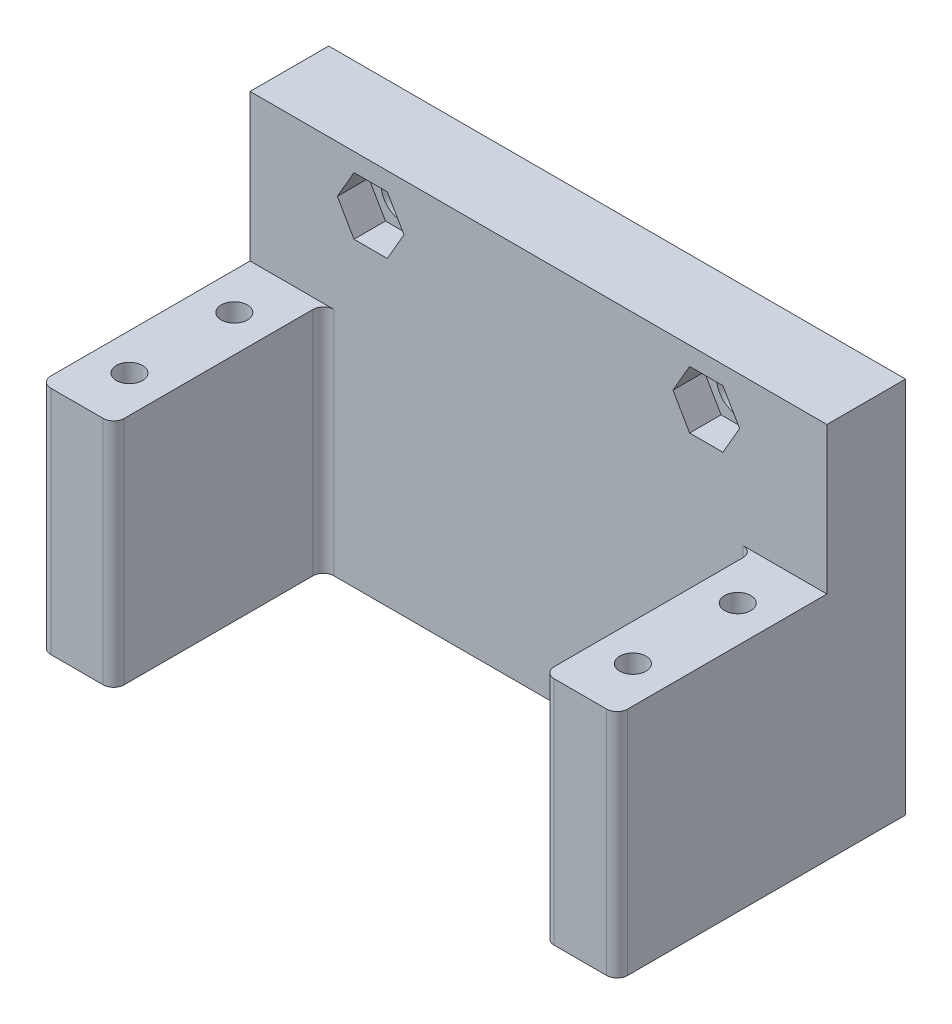
from build123d import *

# Parameters (mm, degrees)
SKETCH1_W           = 55
SKETCH1_H           = 36
SKETCH1_R           = 2
BOSS_EXTRUDE1_DEPTH = 7.5
SKETCH2_W           = 7
SKETCH2_H           = 20
BOSS_EXTRUDE2_DEPTH = 22
SKETCH3_R           = 1.25
CUT_EXTRUDE1_DEPTH  = 10
CUT_EXTRUDE2_DEPTH  = 3
LPATTERN1_COUNT     = 2
LPATTERN1_PITCH     = 32
FILLET1_R           = 1


with BuildPart() as part:
    # Sketch1 → Boss-Extrude1 (new body)
    with BuildSketch(Plane.XY):
        with Locations((27.5, -18)):
            Rectangle(SKETCH1_W, SKETCH1_H)
        with Locations((11.5, -4.5)):
            Circle(SKETCH1_R, mode=Mode.SUBTRACT)
        with Locations((43.5, -4.5)):
            Circle(SKETCH1_R, mode=Mode.SUBTRACT)
    extrude(amount=BOSS_EXTRUDE1_DEPTH)

    # Sketch2 → Boss-Extrude2 (add)
    with BuildSketch(Plane.XZ.offset(36)):
        with Locations((3.5, 17.5)):
            Rectangle(SKETCH2_W, SKETCH2_H)
        with Locations((51.5, 17.5)):
            Rectangle(SKETCH2_W, SKETCH2_H)
    extrude(amount=-BOSS_EXTRUDE2_DEPTH)

    # Sketch3 → Cut-Extrude1 (cut)
    with BuildSketch(Plane(origin=(0, -14, 0), x_dir=(1, 0, 0), z_dir=(0, 1, 0))):
        with Locations((3.5, -12.5)):
            Circle(SKETCH3_R)
        with Locations((51.5, -12.5)):
            Circle(SKETCH3_R)
        with Locations((51.5, -22.5)):
            Circle(SKETCH3_R)
        with Locations((3.5, -22.5)):
            Circle(SKETCH3_R)
    extrude(amount=-CUT_EXTRUDE1_DEPTH, mode=Mode.SUBTRACT)

    # Sketch4 → Cut-Extrude2 (cut)
    with BuildSketch(Plane.XY.offset(7.5)):
        Polygon((13.08771324, -1.75), (9.91228676, -1.75), (8.324573519, -4.5), (9.91228676, -7.25), (13.08771324, -7.25), (14.675426481, -4.5), align=None)
    cut_extrude2 = extrude(amount=-CUT_EXTRUDE2_DEPTH, mode=Mode.SUBTRACT)

    # LPattern1: Cut-Extrude2 ×2
    with Locations(*[(i * LPATTERN1_PITCH, 0, 0) for i in range(1, LPATTERN1_COUNT)]):
        add(cut_extrude2, mode=Mode.SUBTRACT)

    # Fillet1
    fillet1_edges = [part.edges().sort_by_distance(p)[0] for p in [
        (48, -25, 27.5),
        (55, -25, 27.5),
        (7, -25, 27.5),
        (0, -25, 27.5),
        (48, -25, 7.5),
        (7, -25, 7.5),
    ]]
    fillet(fillet1_edges, radius=FILLET1_R)


solid = part.part
